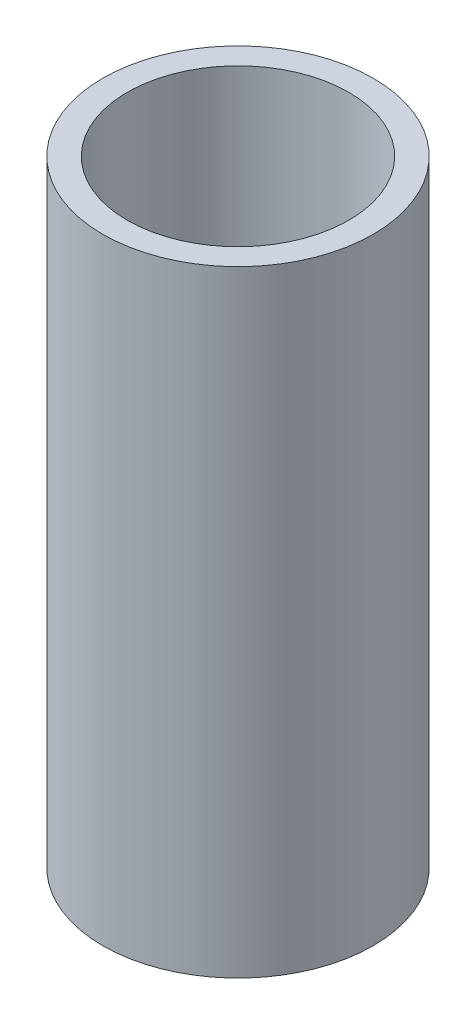
from build123d import *

# Parameters (mm, degrees)
SKETCH1_R           = 17.5
BOSS_EXTRUDE1_DEPTH = 79.750084652
SKETCH2_R           = 14.344290321
CUT_EXTRUDE1_DEPTH  = 84.501952085


with BuildPart() as part:
    # Sketch1 → Boss-Extrude1 (new body)
    with BuildSketch(Plane(origin=(0, 0, 0), x_dir=(1, 0, 0), z_dir=(0, 1, 0))):
        Circle(SKETCH1_R)
    extrude(amount=BOSS_EXTRUDE1_DEPTH)

    # Sketch2 → Cut-Extrude1 (cut, through all)
    with BuildSketch(Plane(origin=(0, 0, 0), x_dir=(1, 0, 0), z_dir=(0, 1, 0))):
        Circle(SKETCH2_R)
    extrude(amount=CUT_EXTRUDE1_DEPTH, mode=Mode.SUBTRACT)


solid = part.part
